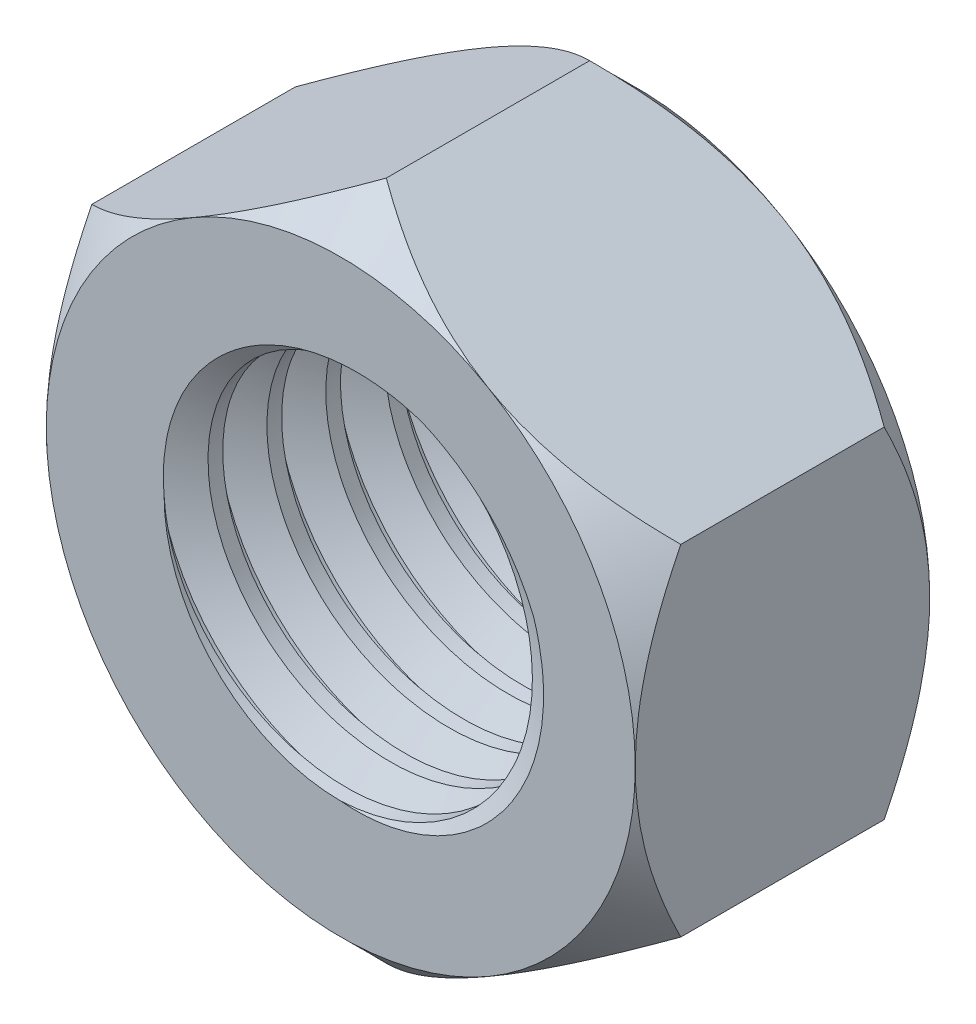
from build123d import *

# Parameters (mm, degrees)
SKETCH1_R               = 3
BOSS_EXTRUDE2_DEPTH     = 2.5
CUT_EXTRUDE1_DEPTH      = 10.128709292
CUT_EXTRUDE1_DEPTH_BACK = 10.128709292
SKETCH2_R               = 3
SKETCH3_OUTSIDE_W       = 35.214
SKETCH3_OUTSIDE_H       = 36.762
SKETCH3_OUTSIDE_R       = 5
CUT_EXTRUDE2_DEPTH      = 10
CUT_EXTRUDE2_DRAFT      = -45
MIRROR1_COPY_1_SKETCH_W = 35.214
MIRROR1_COPY_1_SKETCH_H = 36.762
MIRROR1_COPY_1_SKETCH_R = 5
MIRROR1_COPY_1_DEPTH    = 10
MIRROR1_COPY_1_DRAFT    = -45
THREAD1_PITCH           = 1


with BuildPart() as part:
    # Sketch1 → Boss-Extrude2 (new, symmetric)
    # profile 1 of 2: a face of its own
    with BuildSketch(Plane.XY):
        Polygon((-5, -2.886751346), (0, -5.773502692), (5, -2.886751346), (5, 2.886751346), (0, 5.773502692), (-5, 2.886751346), align=None)
        Circle(SKETCH1_R, mode=Mode.SUBTRACT)
    # profile 2 of 2: a face of its own
    with BuildSketch(Plane.XY):
        Circle(SKETCH1_R)
    extrude(amount=BOSS_EXTRUDE2_DEPTH, both=True)

    # Sketch2 → Cut-Extrude1 (cut, two sides: drawn at the far end of the back side and taken through both)
    with BuildSketch(Plane.XY.offset(2.5).offset(-CUT_EXTRUDE1_DEPTH_BACK)):
        Circle(SKETCH2_R)
    extrude(amount=CUT_EXTRUDE1_DEPTH + CUT_EXTRUDE1_DEPTH_BACK, mode=Mode.SUBTRACT)


with BuildPart() as cut_extrude2_tool:
    # Sketch3 outside → Cut-Extrude2 (with draft: the straight prism first)
    with BuildSketch(Plane.XY.offset(2.5)):
        Rectangle(SKETCH3_OUTSIDE_W, SKETCH3_OUTSIDE_H)
        Circle(SKETCH3_OUTSIDE_R, mode=Mode.SUBTRACT)
    extrude(amount=-CUT_EXTRUDE2_DEPTH)
    # Cut-Extrude2: the draft: its side faces are tilted about the plane it starts from
    cut_extrude2_sides = [cut_extrude2_tool.faces().sort_by_distance(p)[0] for p in [
        (0, -18.381, -2.5),
        (17.607, 0, -2.5),
        (0, 18.381, -2.5),
        (-17.607, 0, -2.5),
        (-5, 0, -2.5),
    ]]
    draft(cut_extrude2_sides, Plane.XY.offset(2.5), CUT_EXTRUDE2_DRAFT)


with BuildPart() as part_1:
    add(part.part)

    # Cut-Extrude2: cut by cut_extrude2_tool
    add(cut_extrude2_tool.part, mode=Mode.SUBTRACT)


with BuildPart() as mirror1_copy_1_tool:
    # Mirror1 copy 1 sketch → Mirror1 copy 1 (with draft: the straight prism first)
    with BuildSketch(Plane(origin=(0, 0, -2.5), x_dir=(1, 0, 0), z_dir=(0, 0, -1))):
        Rectangle(MIRROR1_COPY_1_SKETCH_W, MIRROR1_COPY_1_SKETCH_H)
        Circle(MIRROR1_COPY_1_SKETCH_R, mode=Mode.SUBTRACT)
    extrude(amount=-MIRROR1_COPY_1_DEPTH)
    # Mirror1 copy 1: the draft: its side faces are tilted about the plane it starts from
    mirror1_copy_1_sides = [mirror1_copy_1_tool.faces().sort_by_distance(p)[0] for p in [
        (0, -18.381, 2.5),
        (17.607, 0, 2.5),
        (0, 18.381, 2.5),
        (-17.607, 0, 2.5),
        (-5, 0, 2.5),
    ]]
    draft(mirror1_copy_1_sides, Plane(origin=(0, 0, -2.5), x_dir=(1, 0, 0), z_dir=(0, 0, -1)), MIRROR1_COPY_1_DRAFT)


with BuildPart() as part_2:
    add(part_1.part)

    # Mirror1 copy 1: cut by mirror1_copy_1_tool
    add(mirror1_copy_1_tool.part, mode=Mode.SUBTRACT)

    # Thread1: the profile of Thread Profile1 profile screwed along a left-hand helix of 10 turns, 8 arcs to a turn; built about Z, then put on its axis
    thread1_z = Axis((0, 0, 0), (0, 0, 1))
    thread1_corners = [(2.9997, 0, -0.000173205), (3.541265875, 0, 0.312499999), (3.541265875, 0, 0.437499999), (2.9997, 0, 0.750173202)]
    with BuildLine(mode=Mode.PRIVATE) as thread1_profile:
        Line(thread1_corners[0], thread1_corners[1])
        Line(thread1_corners[1], thread1_corners[2])
        Line(thread1_corners[2], thread1_corners[3])
        Line(thread1_corners[3], thread1_corners[0])
    thread1_cap = Face(thread1_profile.wire())
    thread1_turn_angles = [0, -22.5, -45, -67.5, -90, -112.5, -135, -157.5, -180, -202.5, -225, -247.5, -270, -292.5, -315, -337.5, -360]
    thread1_turn_weights = [1, 0.9238795325112867, 1, 0.9238795325112867, 1, 0.9238795325112867, 1, 0.9238795325112867, 1, 0.9238795325112867, 1, 0.9238795325112867, 1, 0.9238795325112867, 1, 0.9238795325112867, 1]
    thread1_turn_rails = [Edge.make_bspline([Vector(p[0], p[1], 0).rotate(thread1_z, thread1_turn_angles[k]) / thread1_turn_weights[k] + Vector(0, 0, p[2] + -THREAD1_PITCH * thread1_turn_angles[k] / 360) for k in range(17)], [0, 0, 0, 1, 1, 2, 2, 3, 3, 4, 4, 5, 5, 6, 6, 7, 7, 8, 8, 8], 2, thread1_turn_weights) for p in thread1_corners]
    thread1_turn_sides = [Face.make_surface_from_curves(thread1_turn_rails[p[0]], thread1_turn_rails[p[1]]) for p in [(0, 1), (1, 2), (2, 3), (3, 0)]]
    thread1 = Plane(origin=(0, 0, 4.5), x_dir=(-1, 0, 0), z_dir=(0, 0, -1)) * Solid(Shell([*[p.moved(Location((0, 0, THREAD1_PITCH * i))) for i in range(10) for p in thread1_turn_sides], thread1_cap, thread1_cap.rotate(thread1_z, -3600).moved(Location((0, 0, -THREAD1_PITCH * -3600 / 360)))]))
    add(thread1, mode=Mode.SUBTRACT)


solid = part_2.part
